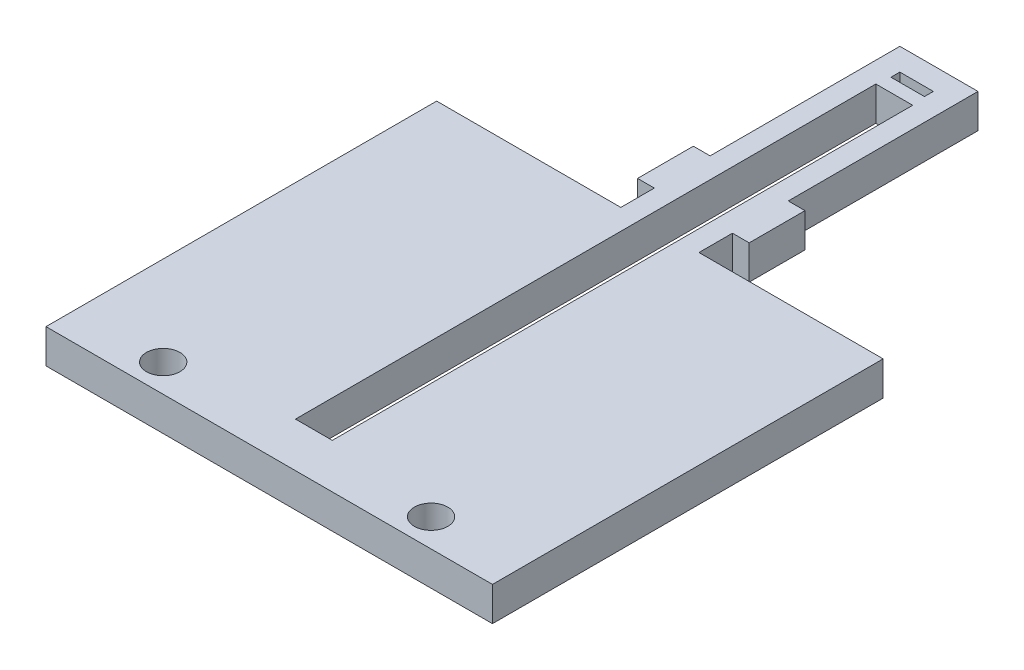
from build123d import *

# Parameters (mm, degrees)
SKETCH1_W           = 40
SKETCH1_H           = 60
BOSS_EXTRUDE1_DEPTH = 3.05
SKETCH4_W           = 3
SKETCH4_H           = 0.8
SKETCH4_W_2         = 3.3
SKETCH4_H_2         = 52
CUT_EXTRUDE1_DEPTH  = 10
CUT_EXTRUDE3_DEPTH  = 10
SKETCH7_R           = 1.5
CUT_EXTRUDE4_DEPTH  = 10


with BuildPart() as part:
    # Sketch1 → Boss-Extrude1 (new body)
    with BuildSketch(Plane(origin=(0, 0, 0), x_dir=(1, 0, 0), z_dir=(0, 1, 0))):
        with Locations((20, 30)):
            Rectangle(SKETCH1_W, SKETCH1_H)
    extrude(amount=BOSS_EXTRUDE1_DEPTH)

    # Sketch4 → Cut-Extrude1 (cut)
    with BuildSketch(Plane(origin=(0, 3.05, 0), x_dir=(1, 0, 0), z_dir=(0, 1, 0))):
        with Locations((20, 57.6)):
            Rectangle(SKETCH4_W, SKETCH4_H)
        with Locations((20, 30)):
            Rectangle(SKETCH4_W_2, SKETCH4_H_2)
    extrude(amount=-CUT_EXTRUDE1_DEPTH, mode=Mode.SUBTRACT)

    # Sketch6 → Cut-Extrude3 (cut)
    with BuildSketch(Plane(origin=(0, 3.05, 0), x_dir=(1, 0, 0), z_dir=(0, 1, 0))):
        Polygon((0, 60), (0, 35), (16.5, 35), (16.5, 38), (15, 38), (15, 43), (16.5, 43), (16.5, 60), align=None)
        Polygon((40, 60), (40, 35), (23.5, 35), (23.5, 38), (25, 38), (25, 43), (23.5, 43), (23.5, 60), align=None)
    extrude(amount=-CUT_EXTRUDE3_DEPTH, mode=Mode.SUBTRACT)

    # Sketch7 → Cut-Extrude4 (cut)
    with BuildSketch(Plane(origin=(0, 3.05, 0), x_dir=(1, 0, 0), z_dir=(0, 1, 0))):
        with Locations((8, 2.5)):
            Circle(SKETCH7_R)
        with Locations((32, 2.5)):
            Circle(SKETCH7_R)
    extrude(amount=-CUT_EXTRUDE4_DEPTH, mode=Mode.SUBTRACT)


solid = part.part
